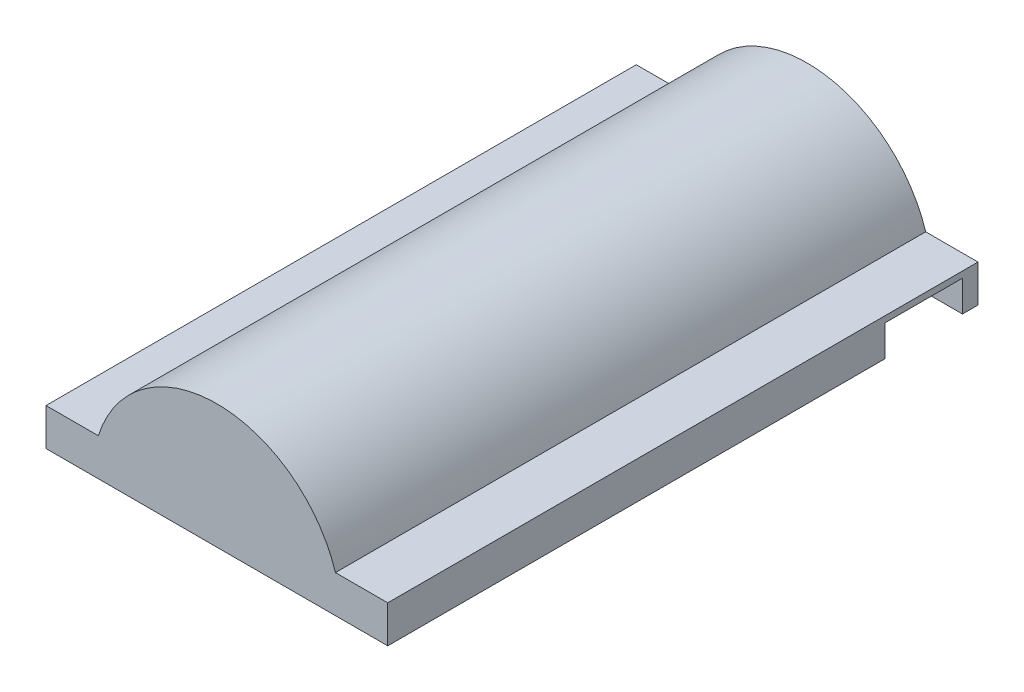
from build123d import *

# Parameters (mm, degrees)
BOSS_EXTRUDE1_DEPTH = 1900
SKETCH2_R           = 300
CUT_EXTRUDE1_DEPTH  = 2232.591360442
SKETCH4_W           = 250
SKETCH4_H           = 100
CUT_EXTRUDE3_DEPTH  = 550
SHELL1_START        = 320
SHELL1_DEPTH        = 1560
SHELL1_START_2      = 20
SHELL1_2_DEPTH      = 300
SHELL1_3_DEPTH      = 10
BOSS_EXTRUDE2_START = -10
BOSS_EXTRUDE2_DEPTH = 10
BOSS_EXTRUDE3_DEPTH = 10


# Read off the part's stored shape, not the designer's step: Shell1
with BuildPart() as part:
    # Sketch1 → Boss-Extrude1 (new body)
    with BuildSketch(Plane.XY):
        with BuildLine():
            Line((931.575680567, 120), (1100, 120))
            Line((1100, 120), (1100, 0))
            Line((1100, 0), (0, 0))
            Line((0, 0), (0, 120))
            Line((0, 120), (168.424319433, 120))
            ThreePointArc((168.424319433, 120), (550, 400), (931.575680567, 120))
        make_face()
    extrude(amount=BOSS_EXTRUDE1_DEPTH)

    # Sketch2 → Cut-Extrude1 (cut, through all)
    with BuildSketch(Plane.XY.offset(1900)):
        with Locations((550, 0)):
            Circle(SKETCH2_R)
    extrude(amount=-CUT_EXTRUDE1_DEPTH, mode=Mode.SUBTRACT)

    # Sketch4 → Cut-Extrude3 (cut)
    with BuildSketch(Plane(origin=(1100, 0, 0), x_dir=(0, 0, -1), z_dir=(1, 0, 0))):
        with Locations((-175, 50)):
            Rectangle(SKETCH4_W, SKETCH4_H)
    extrude(amount=-CUT_EXTRUDE3_DEPTH, mode=Mode.SUBTRACT)

    # Shell1 outline → Shell1 (cut)
    with BuildSketch(Plane.XY.offset(SHELL1_START)):
        with BuildLine():
            ThreePointArc((916.606055596, 100), (550, 380), (183.393944404, 100))
            Line((183.393944404, 100), (20, 100))
            Line((20, 100), (20, 0))
            Line((20, 0), (250, 0))
            ThreePointArc((250, 0), (550, 300), (850, 0))
            Line((850, 0), (1080, 0))
            Line((1080, 0), (1080, 100))
            Line((1080, 100), (916.606055596, 100))
        make_face()
    extrude(amount=SHELL1_DEPTH, mode=Mode.SUBTRACT)

    # Shell1 2 outline → Shell1 2 (cut)
    with BuildSketch(Plane.XY.offset(SHELL1_START_2)):
        with BuildLine():
            Line((824.954541697, 120), (910.555127546, 120))
            ThreePointArc((910.555127546, 120), (539.552347988, 379.856349911), (183.393944404, 100))
            Line((183.393944404, 100), (20, 100))
            Line((20, 100), (20, 0))
            Line((20, 0), (250, 0))
            ThreePointArc((250, 0), (488.707106893, 293.671893879), (824.954541697, 120))
        make_face()
    extrude(amount=SHELL1_2_DEPTH, mode=Mode.SUBTRACT)

    # Shell1 3 outline → Shell1 3 (cut)
    with BuildSketch(Plane.XY.offset(SHELL1_START_2)):
        with BuildLine():
            ThreePointArc((916.606055596, 100), (913.718086665, 110.041598646), (910.555127546, 120))
            Line((910.555127546, 120), (824.954541697, 120))
            ThreePointArc((824.954541697, 120), (843.671893879, 61.292893107), (850, 0))
            Line((850, 0), (1080, 0))
            Line((1080, 0), (1080, 100))
            Line((1080, 100), (916.606055596, 100))
        make_face()
    extrude(amount=SHELL1_3_DEPTH, mode=Mode.SUBTRACT)

    # Sketch5 → Boss-Extrude2 (add)
    with BuildSketch(Plane(origin=(0, 0, 0), x_dir=(-1, 0, 0), z_dir=(0, 0, -1)).offset(BOSS_EXTRUDE2_START)):
        with BuildLine():
            Line((-850, 0), (-250, 0))
            ThreePointArc((-250, 0), (-550, 300), (-850, 0))
        make_face()
    extrude(amount=BOSS_EXTRUDE2_DEPTH)

    # Sketch6 → Boss-Extrude3 (add)
    with BuildSketch(Plane.XY.offset(1900)):
        with BuildLine():
            Line((850, 0), (250, 0))
            ThreePointArc((250, 0), (550, 300), (850, 0))
        make_face()
    extrude(amount=-BOSS_EXTRUDE3_DEPTH)


solid = part.part
